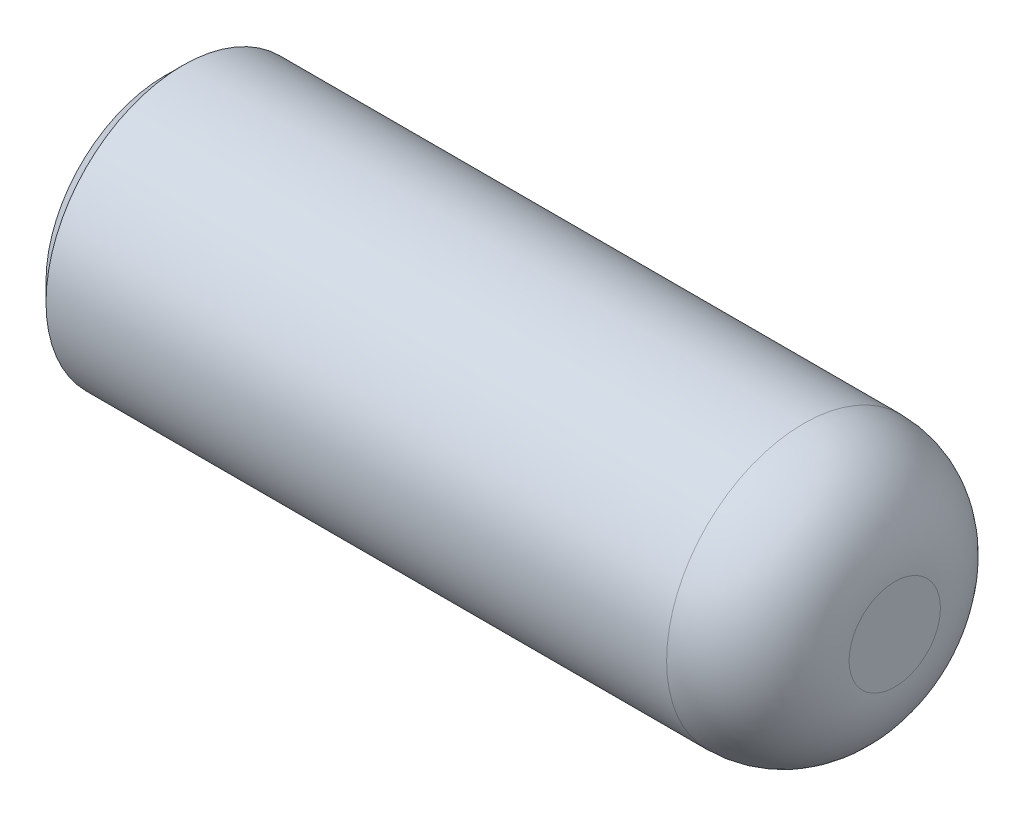
from build123d import *

# Parameters (mm, degrees)
SKETCH1_R           = 1.5
BOSS_EXTRUDE1_DEPTH = 4
FILLET1_R           = 1
CHAMFER1_SIZE       = 0.2


with BuildPart() as part:
    # Sketch1 → Boss-Extrude1 (new, symmetric)
    with BuildSketch(Plane(origin=(0, 0, 0), x_dir=(0, -1, 0), z_dir=(1, 0, 0))):
        Circle(SKETCH1_R)
    extrude(amount=BOSS_EXTRUDE1_DEPTH, both=True)

    # Fillet1
    fillet1_edges = [part.edges().sort_by_distance(p)[0] for p in [
        (4, 1.5, 0),
    ]]
    fillet(fillet1_edges, radius=FILLET1_R)

    # Chamfer1
    chamfer1_edges = [part.edges().sort_by_distance(p)[0] for p in [
        (-4, 1.5, 0),
    ]]
    chamfer(chamfer1_edges, length=CHAMFER1_SIZE)


solid = part.part
